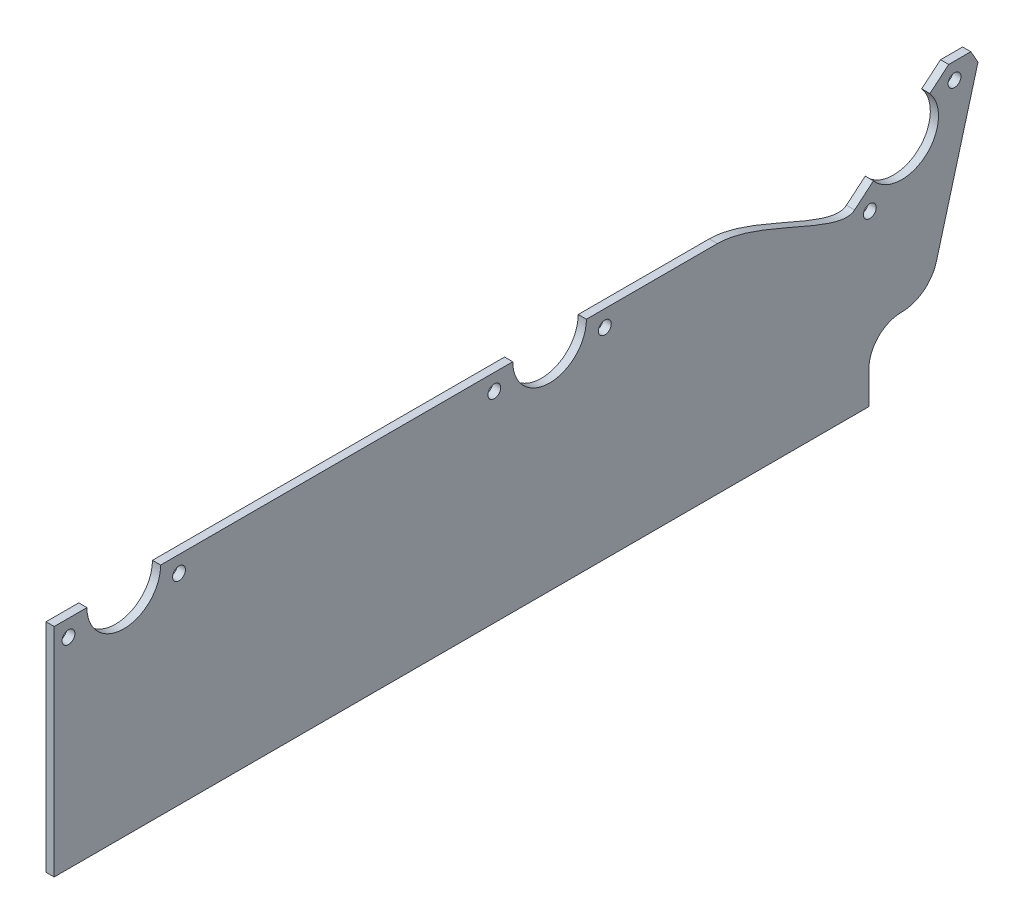
from build123d import *

# Parameters (mm, degrees)
BOSS_EXTRUDE1_DEPTH    = 3.175
F_10_CLEARANCE_HOLE1_D = 4.9784
CHAMFER1_SIZE          = 5.08
CHAMFER1_SIZE2         = 4.134495326


with BuildPart() as part:
    # Sketch1 → Boss-Extrude1 (new body)
    with BuildSketch(Plane(origin=(0, 0, 0), x_dir=(0, 0, -1), z_dir=(1, 0, 0))):
        with BuildLine():
            Line((-12.7, -12.7), (-328.6125, -12.7))
            Line((-328.6125, -12.7), (-328.6125, 71.4375))
            Line((-328.6125, 71.4375), (-315.9125, 71.4375))
            ThreePointArc((-315.9125, 71.4375), (-301.625, 57.15), (-287.3375, 71.4375))
            Line((-287.3375, 71.4375), (-150.8125, 71.4375))
            ThreePointArc((-150.8125, 71.4375), (-136.525, 57.15), (-122.2375, 71.4375))
            Line((-122.2375, 71.4375), (-71.4375, 71.4375))
            add(Edge.make_bspline(
                [(-18.243165022, 56.129666959), (-24.729007974, 50.68739853), (-54.504166667, 71.4375), (-71.4375, 71.4375)],
                knots=[0, 0, 0, 0, 1, 1, 1, 1], degree=3))
            Line((-18.243165022, 56.129666959), (-10.944859981, 62.253672027))
            ThreePointArc((-10.944859981, 62.253672027), (9.183827973, 60.492640019), (10.944859981, 80.621327973))
            Line((10.944859981, 80.621327973), (18.243165022, 86.745333041))
            Line((18.243165022, 86.745333041), (30.943165022, 86.745333041))
            Line((30.943165022, 86.745333041), (13.473517024, 22.978761859))
            ThreePointArc((13.473517024, 22.978761859), (8.473319986, 15.563076555), (0, 12.7))
            ThreePointArc((0, 12.7), (-8.980256121, 8.980256121), (-12.7, 0))
            Line((-12.7, 0), (-12.7, -12.7))
        make_face()
    extrude(amount=BOSS_EXTRUDE1_DEPTH)

    # #10 Clearance Hole1 (through all)
    with Locations(Plane(origin=(3.175, 0, 0), x_dir=(0, 0, -1), z_dir=(1, 0, 0))):
        with Locations((-323.05625, 65.0875), (-280.19375, 65.0875), (-157.95625, 65.0875), (-115.09375, 65.0875), (-12.33558865, 52.797375826), (20.498991293, 80.348859746)):
            Hole(F_10_CLEARANCE_HOLE1_D / 2)

    # Chamfer1
    chamfer1_edges = [part.edges().sort_by_distance(p)[0] for p in [
        (1.5875, 86.745333041, -30.943165022),
    ]]
    chamfer1_side = [part.faces().sort_by_distance(p)[0] for p in [
        (1.5875, 54.86204745, -22.208341023),
    ]]
    chamfer(chamfer1_edges, length=CHAMFER1_SIZE, length2=CHAMFER1_SIZE2, reference=chamfer1_side[0])


solid = part.part
